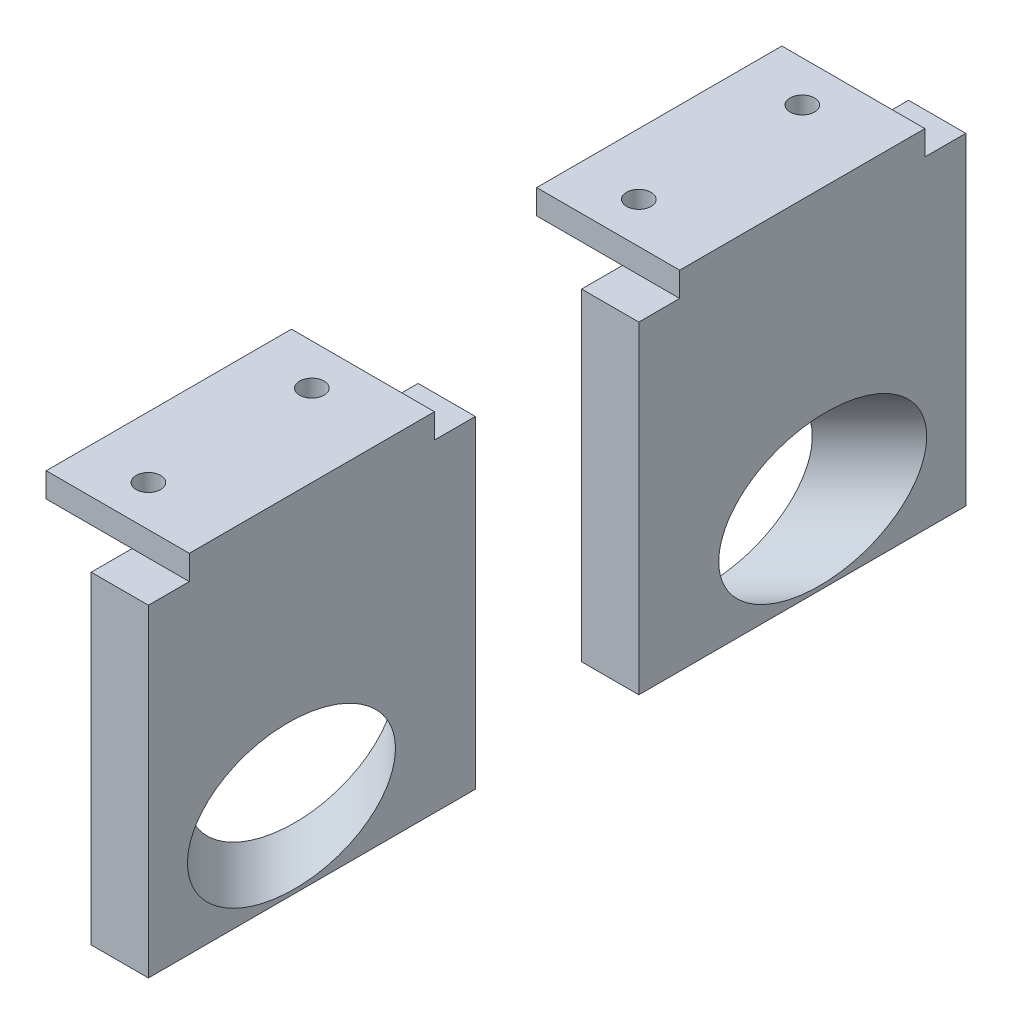
from build123d import *

# Parameters (mm, degrees)
EXTRUDE_1_DEPTH      = 5
EXTRUDE_1_DEPTH_BACK = 2
SKETCH_1_W           = 40
SKETCH_1_H           = 39.5
SKETCH_3_W           = 17.5
SKETCH_3_H           = 30
EXTRUDE_2_DEPTH      = 3
SKETCH_6_R           = 1.5
CUT_EXTRUDE_2_DEPTH  = 3
CUT_EXTRUDE_START    = -15.556349186
CUT_EXTRUDE_3_DEPTH  = 29.85530071


with BuildPart() as part:
    # 草图1 → 凸台-拉伸1 (new, two sides: drawn at the far end of the back side and taken through both)
    with BuildSketch(Plane(origin=(0, 0, 0), x_dir=(0, 0, -1), z_dir=(1, 0, 0)).offset(-EXTRUDE_1_DEPTH_BACK)):
        with Locations((0, -8.75)):
            Rectangle(SKETCH_1_W, SKETCH_1_H)
    extrude(amount=EXTRUDE_1_DEPTH + EXTRUDE_1_DEPTH_BACK)

    # 草图3 → 凸台-拉伸2 (add)
    with BuildSketch(Plane(origin=(0, 11, 0), x_dir=(1, 0, 0), z_dir=(0, 1, 0))):
        with Locations((-3.75, 0)):
            Rectangle(SKETCH_3_W, SKETCH_3_H)
    extrude(amount=EXTRUDE_2_DEPTH)

    # 草图6 → 切除-拉伸2 (cut)
    with BuildSketch(Plane(origin=(0, 14, 0), x_dir=(1, 0, 0), z_dir=(0, 1, 0))):
        with Locations(Location((-5, 10, 0), (0, 0, 270))):
            Circle(SKETCH_6_R)
        with Locations(Location((-5, -10, 0), (0, 0, 270))):
            Circle(SKETCH_6_R)
    extrude(amount=-CUT_EXTRUDE_2_DEPTH, mode=Mode.SUBTRACT)

    # 切除-拉伸3: read off the stored shape, not the designer's step
    # 切除-拉伸3 outline → 切除-拉伸3 (cut)
    with BuildSketch(Plane(origin=(0, 0, 0), x_dir=(0.7071067811865441, 0, -0.707106781186551), z_dir=(0.707106781186551, 0, 0.707106781186544)).offset(CUT_EXTRUDE_START)):
        with BuildLine():
            add(Edge.make_bspline(
                [(-7.223484622, -18.437173001), (-7.710904116, -34.010382191), (6.019682993, -27.068018094), (19.750270103, -20.125653997), (6.507102488, -11.494808904), (-6.736065128, -2.863963811), (-7.223484622, -18.437173001)],
                knots=[0, 0, 0, 2.094395102, 2.094395102, 4.188790205, 4.188790205, 6.283185307, 6.283185307, 6.283185307], degree=2, weights=[1, 0.5, 1, 0.5, 1, 0.5, 1]))
        make_face()
    extrude(amount=CUT_EXTRUDE_3_DEPTH, mode=Mode.SUBTRACT)


with BuildPart() as body_2:
    # 镜向1: mirrored copy
    add(part.part.mirror(Plane(origin=(0, 0, -30), x_dir=(1, 0, 0), z_dir=(0, 0, -1))))


solid = Compound([part.part, body_2.part])
